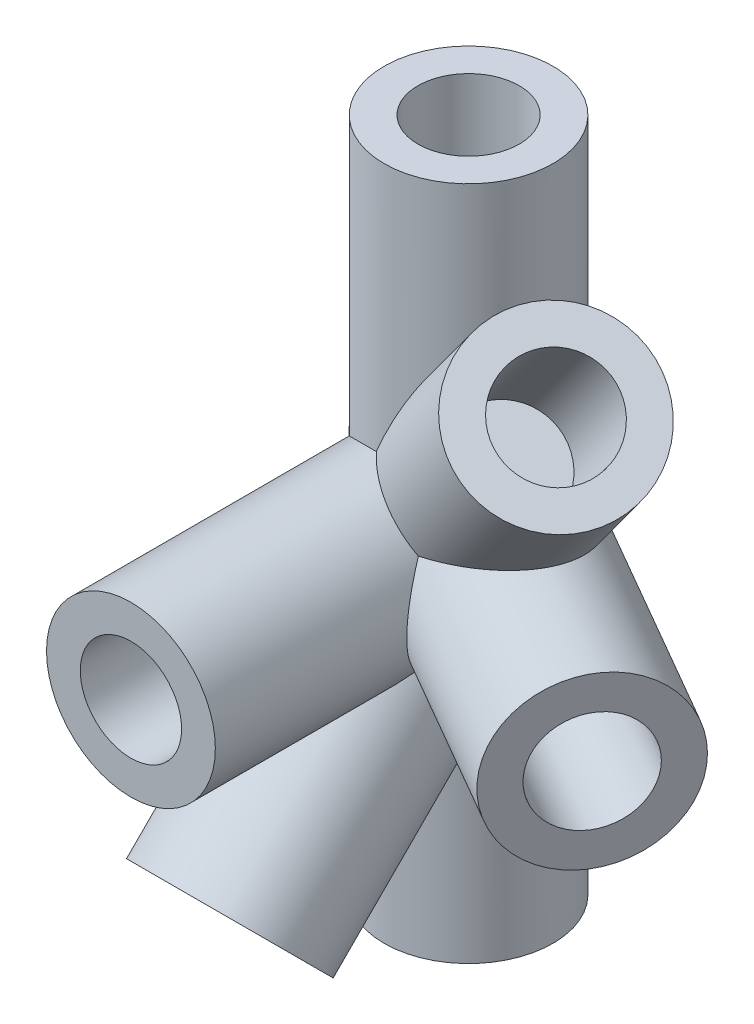
from build123d import *
from OCP.BRepAlgoAPI import BRepAlgoAPI_Cut
from OCP.TopTools import TopTools_ListOfShape

# Parameters (mm, degrees)
SKETCH1_R                = 5
BOSS_EXTRUDE1_DEPTH      = 40
SKETCH2_R                = 5
BOSS_EXTRUDE2_DEPTH      = 20
SKETCH4_R                = 5
BOSS_EXTRUDE3_DEPTH      = 20
BOSS_EXTRUDE4_DEPTH      = 10
BOSS_EXTRUDE4_DEPTH_BACK = 13.827204
SKETCH6_R                = 5
SKETCH8_R                = 5
CUT_EXTRUDE1_DEPTH       = 3.827204
SKETCH13_R               = 5
BOSS_EXTRUDE5_DEPTH      = 20
SKETCH14_R               = 3
CUT_EXTRUDE2_DEPTH       = 12
CUT_EXTRUDE3_START       = -12
SKETCH15_R               = 3
CUT_EXTRUDE3_DEPTH       = 12
SKETCH16_R               = 3
CUT_EXTRUDE4_DEPTH       = 12
SKETCH17_R               = 3
CUT_EXTRUDE5_DEPTH       = 12
SKETCH18_R               = 3
CUT_EXTRUDE6_DEPTH       = 12
SKETCH19_R               = 3
CUT_EXTRUDE7_DEPTH       = 12


with BuildPart() as part:
    # Sketch1 → Boss-Extrude1 (new body)
    with BuildSketch(Plane(origin=(0, 0, 0), x_dir=(1, 0, 0), z_dir=(0, 1, 0))):
        with Locations(Location((0, 0, 0), (0, 0, 270))):
            Circle(SKETCH1_R)
    extrude(amount=BOSS_EXTRUDE1_DEPTH)

    # Sketch2 → Boss-Extrude2 (add)
    with BuildSketch(Plane.XY):
        with Locations((0, 20)):
            Circle(SKETCH2_R)
    extrude(amount=BOSS_EXTRUDE2_DEPTH)

    # Sketch4 → Boss-Extrude3 (add)
    with BuildSketch(Plane(origin=(0, 10, -10), x_dir=(-1, 0, 0), z_dir=(0, -0.7071067811865475, 0.7071067811865477))):
        with Locations(Location((0, -14.142135624, 0), (0, 0, 90))):
            Circle(SKETCH4_R)
    extrude(amount=BOSS_EXTRUDE3_DEPTH)

    # Sketch6 → Boss-Extrude4 (add, two sides: drawn at the far end of the back side and taken through both)
    with BuildSketch(Plane(origin=(11.97471023, 0, 6.913602175), x_dir=(0.49999999999999756, 0, -0.86602540378444), z_dir=(0.86602540378444, 0, 0.49999999999999756)).offset(-BOSS_EXTRUDE4_DEPTH_BACK)):
        with Locations((0, 20)):
            Circle(SKETCH6_R)
    extrude(amount=BOSS_EXTRUDE4_DEPTH + BOSS_EXTRUDE4_DEPTH_BACK)

    # Sketch8 → Cut-Extrude1 (cut)
    with BuildSketch(Plane(origin=(20.634964268, 0, 11.913602175), x_dir=(0.49999999999999756, 0, -0.86602540378444), z_dir=(0.86602540378444, 0, 0.49999999999999756))):
        with Locations((0, 20)):
            Circle(SKETCH8_R)
    extrude(amount=-CUT_EXTRUDE1_DEPTH, mode=Mode.SUBTRACT)

    # Sketch13 → Boss-Extrude5 (add)
    with BuildSketch(Plane(origin=(8.660254038, 10, 5), x_dir=(0.7905694150420939, -0.5477225575051677, -0.2738612787525826), z_dir=(0.6123724356957958, 0.7071067811865471, 0.3535533905932725))):
        with Locations(Location((-10.95445115, 8.94427191, 0), (0, 0, 50.768479516))):
            Circle(SKETCH13_R)
    extrude(amount=BOSS_EXTRUDE5_DEPTH)

    # Sketch14 → Cut-Extrude2 (cut)
    with BuildSketch(Plane(origin=(0, 40, 0), x_dir=(1, 0, 0), z_dir=(0, 1, 0))):
        with Locations(Location((0, 0, 0), (0, 0, 270))):
            Circle(SKETCH14_R)
    extrude(amount=-CUT_EXTRUDE2_DEPTH, mode=Mode.SUBTRACT)

    # Sketch15 → Cut-Extrude3 (cut)
    with BuildSketch(Plane.XZ.offset(CUT_EXTRUDE3_START)):
        with Locations(Location((0, 0, 0), (0, 0, 90))):
            Circle(SKETCH15_R)
    extrude(amount=CUT_EXTRUDE3_DEPTH, mode=Mode.SUBTRACT)

    # Sketch16 → Cut-Extrude4 (cut)
    with BuildSketch(Plane(origin=(0, -4.142135624, 4.142135624), x_dir=(1, 0, 0), z_dir=(0, -0.7071067811865476, 0.7071067811865476))):
        with Locations(Location((0, 14.142135624, 0), (0, 0, 270))):
            Circle(SKETCH16_R)
    extrude(amount=-CUT_EXTRUDE4_DEPTH, mode=Mode.SUBTRACT)

    # Sketch17 → Cut-Extrude5 (cut)
    with BuildSketch(Plane.XY.offset(20)):
        with Locations((0, 20)):
            Circle(SKETCH17_R)
    extrude(amount=-CUT_EXTRUDE5_DEPTH, mode=Mode.SUBTRACT)


with BuildPart() as cut_extrude6_tool:
    # Sketch18 → Cut-Extrude6 (new body)
    with BuildSketch(Plane(origin=(17.320508076, 0, 10), x_dir=(0.49999999999999756, 0, -0.86602540378444), z_dir=(0.86602540378444, 0, 0.49999999999999756))):
        with Locations((0, 20)):
            Circle(SKETCH18_R)
    extrude(amount=-CUT_EXTRUDE6_DEPTH)


with BuildPart() as part_1:
    add(part.part)

    # Cut-Extrude6: cut by cut_extrude6_tool, with a tolerance
    cut_extrude6_stock = TopTools_ListOfShape()
    cut_extrude6_stock.Append(part_1.part.wrapped)
    cut_extrude6_tools = TopTools_ListOfShape()
    cut_extrude6_tools.Append(cut_extrude6_tool.part.wrapped)
    cut_extrude6_cut = BRepAlgoAPI_Cut()
    cut_extrude6_cut.SetArguments(cut_extrude6_stock)
    cut_extrude6_cut.SetTools(cut_extrude6_tools)
    cut_extrude6_cut.SetFuzzyValue(0.00001)
    cut_extrude6_cut.Build()
    add(Compound.cast(cut_extrude6_cut.Shape()).solids(), mode=Mode.REPLACE)

    # Sketch19 → Cut-Extrude7 (cut)
    with BuildSketch(Plane(origin=(20.907702752, 24.142135624, 12.071067812), x_dir=(0.7905694150420939, -0.5477225575051676, -0.273861278752583), z_dir=(0.6123724356957958, 0.7071067811865471, 0.35355339059327245))):
        with Locations(Location((-10.95445115, 8.94427191, 0), (0, 0, 162.976133815))):
            Circle(SKETCH19_R)
    extrude(amount=-CUT_EXTRUDE7_DEPTH, mode=Mode.SUBTRACT)


solid = part_1.part
